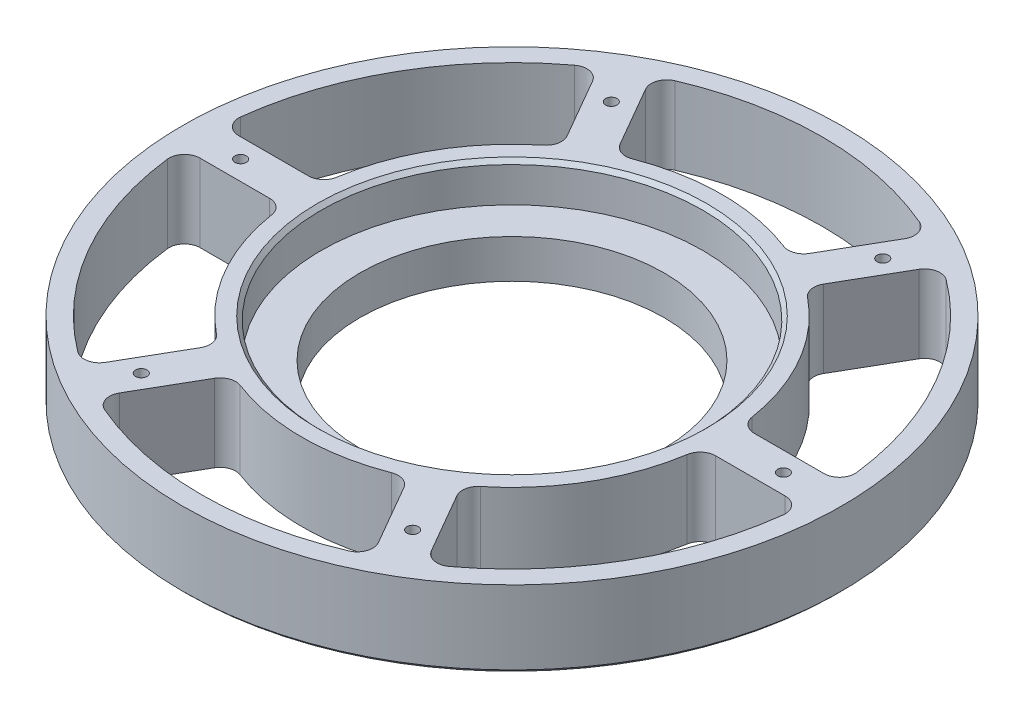
from build123d import *

# Parameters (mm, degrees)
F_32_0_116_DIAMETER_HOLE1_D = 2.9464
CIRPATTERN3_COUNT           = 6
CUT_EXTRUDE1_DEPTH          = 122.86033891327318
FILLET1_R                   = 4
CIRPATTERN4_COUNT           = 6
FILLET1_OF_CIRPATTERN4_R    = 4
CHAMFER1_SIZE               = 1
CHAMFER2_SIZE               = 1


with BuildPart() as part:
    # Sketch2 → Revolve1 (revolve)
    with BuildSketch(Plane(origin=(0, 0, 0), x_dir=(0, 0, -1), z_dir=(1, 0, 0))):
        Polygon((-39.2125, -8.7e-16), (-84.99983, -5.61e-15), (-84.99983, 19.999999999999993), (-49.2125, 19.999999999999993), (-49.21250000000001, 9.999999999999993), (-39.21250000000001, 9.999999999999991), align=None)
    revolve(axis=Axis((0, -0.7500000000000007, 0), (0, 1, 0)))

    # #32 (0.116) Diameter Hole1 (through all)
    with Locations(Plane(origin=(0, 19.999999999999993, 0), x_dir=(1, 0, 0), z_dir=(0, 1, 0))):
        with Locations((-35, 60.621778265)):
            f_32_0_116_diameter_hole1 = Hole(F_32_0_116_DIAMETER_HOLE1_D / 2)

    # CirPattern3: #32 (0.116) Diameter Hole1 ×6 about axis
    cirpattern3_axis = Axis((0, -0.7500000000000007, 0), (0, 1, 0))
    for i in range(1, CIRPATTERN3_COUNT):
        add(f_32_0_116_diameter_hole1.rotate(cirpattern3_axis, i * 360 / CIRPATTERN3_COUNT), mode=Mode.SUBTRACT)

    # Sketch8 → Cut-Extrude1 (cut, through all)
    with BuildSketch(Plane(origin=(0, 19.999999999999993, 0), x_dir=(1, 0, 0), z_dir=(0, 1, 0))):
        with BuildLine():
            Line((-35.59158637125224, 71.64643591698466), (-22.660589701137393, 49.249292691841845))
            ThreePointArc((-22.660589701137393, 49.249292691841845), (3.32e-15, 54.212500000000006), (22.660589701137393, 49.249292691841845))
            Line((22.660589701137393, 49.249292691841845), (35.59158637125224, 71.64643591698466))
            ThreePointArc((35.59158637125224, 71.64643591698466), (4.9e-15, 79.99982999999999), (-35.59158637125224, 71.64643591698466))
        make_face()
    cut_extrude1 = extrude(amount=-CUT_EXTRUDE1_DEPTH, mode=Mode.SUBTRACT)

    # Fillet1
    fillet1_edges = [part.edges().sort_by_distance(p)[0] for p in [
        (35.59158637125225, 9.999999999999996, -71.64643591698467),
        (22.660589701137397, 9.999999999999996, -49.249292691841845),
        (-35.591586371252234, 9.999999999999996, -71.64643591698467),
        (-22.660589701137393, 9.999999999999996, -49.249292691841845),
    ]]
    fillet(fillet1_edges, radius=FILLET1_R)

    # CirPattern4: Cut-Extrude1 ×6 about axis
    cirpattern4_axis = Axis((0, -0.7500000000000007, 0), (0, 1, 0))
    for i in range(1, CIRPATTERN4_COUNT):
        add(cut_extrude1.rotate(cirpattern4_axis, i * 360 / CIRPATTERN4_COUNT), mode=Mode.SUBTRACT)

    # Fillet1 of CirPattern4
    fillet1_of_cirpattern4_edges = [part.edges().sort_by_distance(p)[0] for p in [
        (-44.25184040909643, 9.999999999999996, -66.64643591698479),
        (-31.320843738981637, 9.999999999999996, -44.24929269184193),
        (-79.84342678034868, 9.999999999999996, -4.999999999999904),
        (-53.981433440119034, 9.999999999999996, -4.999999999999929),
        (-79.84342678034868, 9.999999999999996, 4.9999999999998685),
        (-53.981433440119034, 9.999999999999996, 4.999999999999904),
        (-44.25184040909645, 9.999999999999996, 66.64643591698476),
        (-31.32084373898165, 9.999999999999996, 44.249292691841916),
        (-35.591586371252255, 9.999999999999996, 71.64643591698467),
        (-22.660589701137404, 9.999999999999996, 49.249292691841845),
        (35.59158637125223, 9.999999999999996, 71.64643591698467),
        (22.660589701137386, 9.999999999999996, 49.249292691841845),
        (44.2518404090964, 9.999999999999996, 66.64643591698481),
        (31.320843738981612, 9.999999999999996, 44.249292691841944),
        (79.84342678034866, 9.999999999999996, 4.999999999999936),
        (53.98143344011903, 9.999999999999996, 4.999999999999947),
        (79.84342678034868, 9.999999999999996, -4.999999999999893),
        (53.981433440119034, 9.999999999999996, -4.999999999999925),
        (44.25184040909643, 9.999999999999996, -66.64643591698479),
        (31.320843738981637, 9.999999999999996, -44.24929269184193),
    ]]
    fillet(fillet1_of_cirpattern4_edges, radius=FILLET1_OF_CIRPATTERN4_R)

    # Chamfer1
    chamfer1_edges = [part.edges().sort_by_distance(p)[0] for p in [
        (6.03e-15, 19.999999999999993, -49.2125),
    ]]
    chamfer(chamfer1_edges, length=CHAMFER1_SIZE)

    # Chamfer2
    chamfer2_edges = [part.edges().sort_by_distance(p)[0] for p in [
        (1.041e-14, -5.66e-15, -84.99983),
    ]]
    chamfer(chamfer2_edges, length=CHAMFER2_SIZE)


solid = part.part
